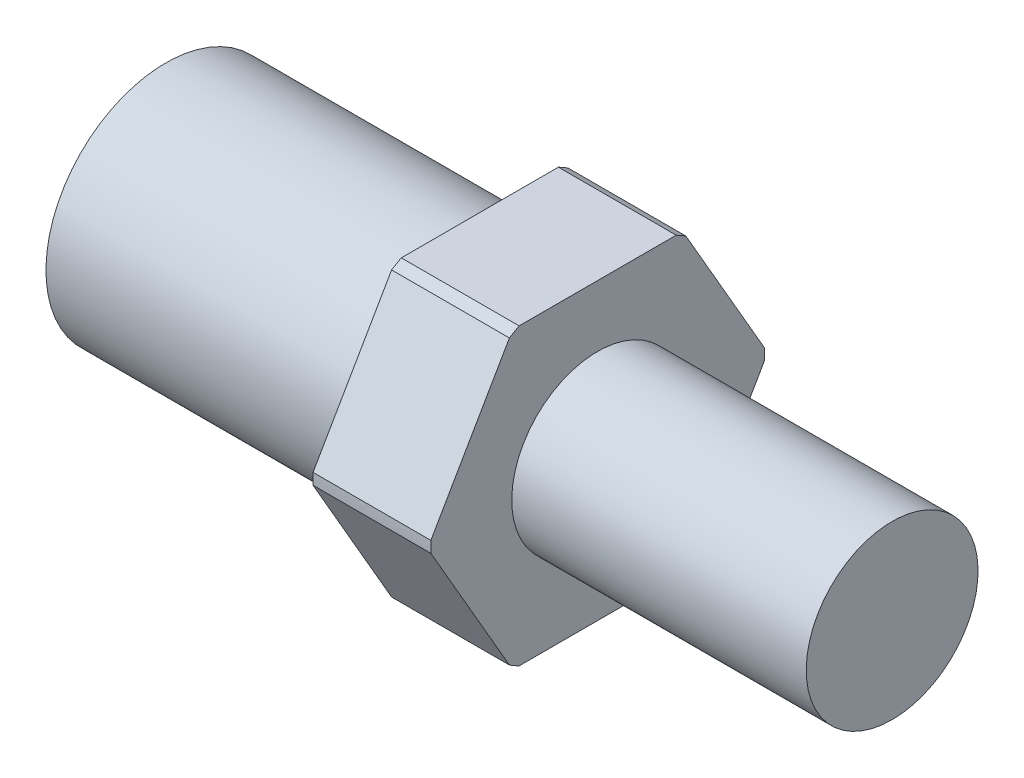
from build123d import *

# Parameters (mm, degrees)
CUT_EXTRUDE1_DEPTH      = 31.730326227
CUT_EXTRUDE1_DEPTH_BACK = 31.730326227
SKETCH2_OUTSIDE_W       = 34.798
SKETCH2_OUTSIDE_H       = 34.798


with BuildPart() as part:
    # Sketch1 → Revolve1 (revolve)
    with BuildSketch(Plane.XY):
        Polygon((0, 10.795), (-7.62, 10.795), (-7.62, 7.747), (-27.94, 7.747), (-27.94, 0), (19.05, 0), (19.05, 5.55625), (0, 5.55625), align=None)
    revolve(axis=Axis((-27.94, 0, 0), (1, 0, 0)))

    # Sketch2 outside → Cut-Extrude1 (cut, two sides: drawn at the far end of the back side and taken through both)
    with BuildSketch(Plane.ZY.offset(7.62).offset(-CUT_EXTRUDE1_DEPTH_BACK)):
        Rectangle(SKETCH2_OUTSIDE_W, SKETCH2_OUTSIDE_H)
        Polygon((-5.499261314, 9.525), (-10.998522628, 0), (-5.499261314, -9.525), (5.499261314, -9.525), (10.998522628, 0), (5.499261314, 9.525), align=None, mode=Mode.SUBTRACT)
    extrude(amount=CUT_EXTRUDE1_DEPTH + CUT_EXTRUDE1_DEPTH_BACK, mode=Mode.SUBTRACT)


solid = part.part
